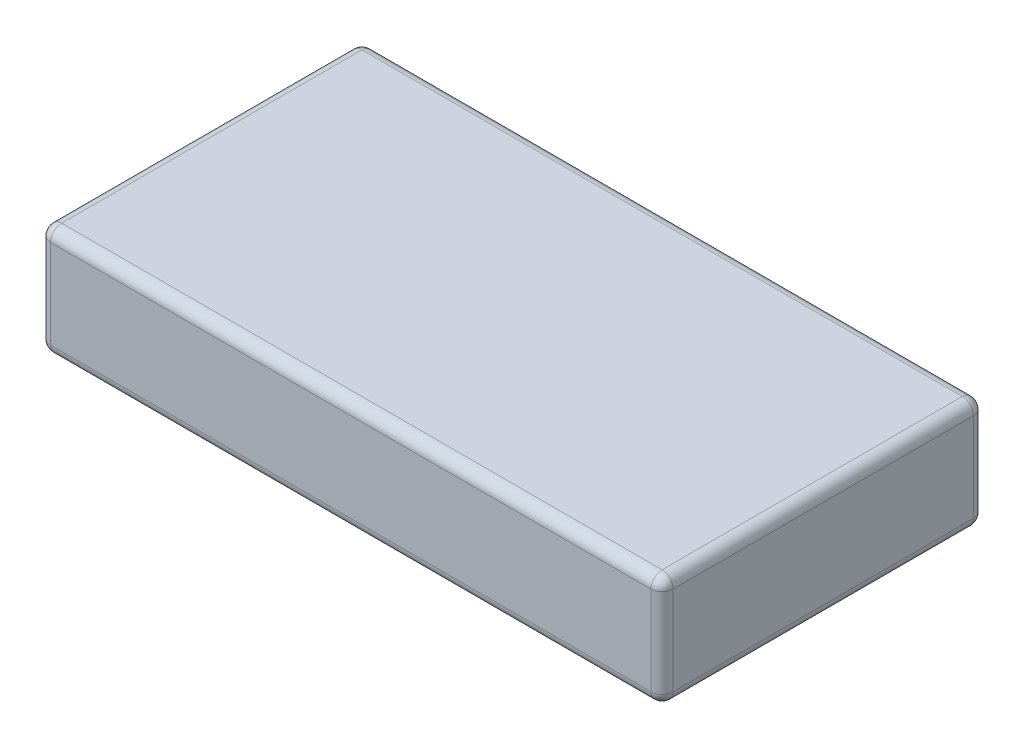
from build123d import *

# Parameters (mm, degrees)
SKETCH_1_W      = 56
SKETCH_1_H      = 29
EXTRUDE_1_DEPTH = 10
FILLET_1_R      = 1


with BuildPart() as part:
    # 草图1 → 凸台-拉伸1 (new body)
    with BuildSketch(Plane(origin=(0, 0, 0), x_dir=(1, 0, 0), z_dir=(0, 1, 0))):
        Rectangle(SKETCH_1_W, SKETCH_1_H)
    extrude(amount=EXTRUDE_1_DEPTH)

    # 圆角1
    fillet_1_edges = [part.edges().sort_by_distance(p)[0] for p in [
        (-28, 5, -14.5),
        (28, 5, -14.5),
        (-28, 5, 14.5),
        (28, 5, 14.5),
        (0, 0, -14.5),
        (-28, 0, 0),
        (0, 0, 14.5),
        (28, 0, 0),
        (0, 10, 14.5),
        (-28, 10, 0),
        (0, 10, -14.5),
        (28, 10, 0),
    ]]
    fillet(fillet_1_edges, radius=FILLET_1_R)


solid = part.part
